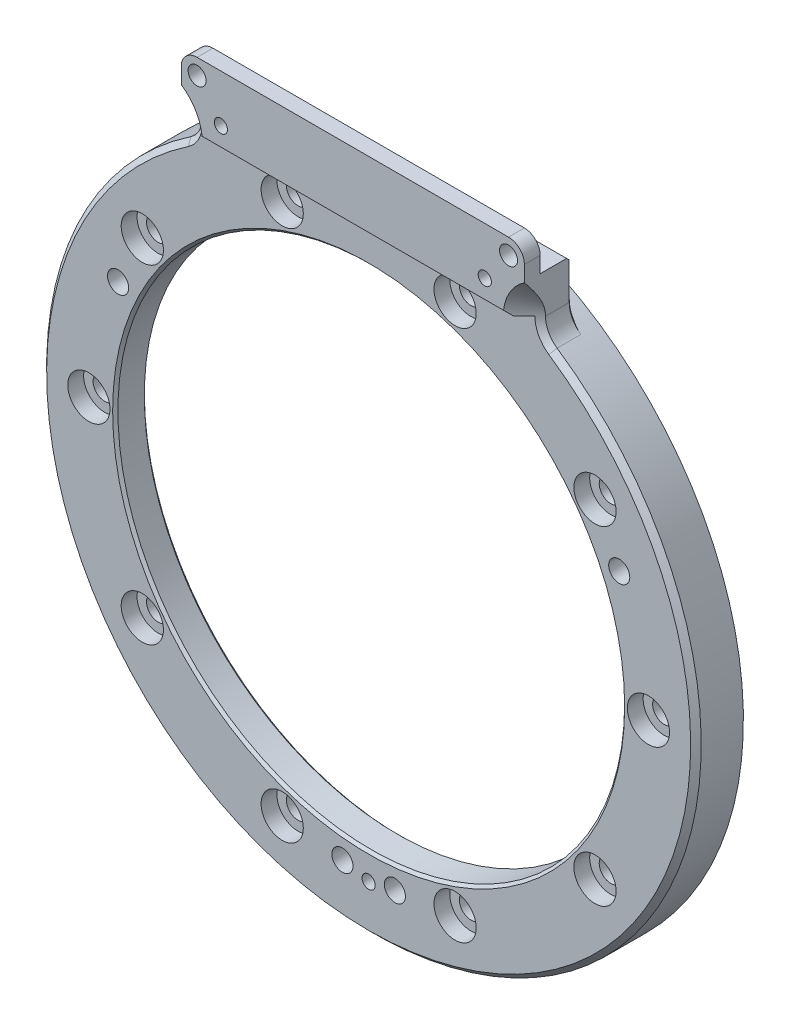
from build123d import *

# Parameters (mm, degrees)
SKETCH_1_R             = 62
SKETCH_1_R_2           = 60
EXTRUDE_1_DEPTH        = 3
EXTRUDE_START          = 6
SKETCH_2_R             = 48
EXTRUDE_2_DEPTH        = 6
FILLET_1_R             = 5
CHAMFER_1_SIZE         = 0.5
CHAMFER_2_SIZE         = 0.5
SKETCH_6_R             = 2.2
CUT_EXTRUDE_1_DEPTH    = 6
SKETCH_7_W             = 65
SKETCH_7_H             = 13.477482046
EXTRUDE_3_DEPTH        = 3
SKETCH_11_R            = 1.7
CUT_EXTRUDE_2_DEPTH    = 3
CHAMFER_3_SIZE         = 1
CHAMFER_4_SIZE         = 1
FILLET_2_R             = 3
CHAMFER_5_3_ANGLE      = 291.929687
SKETCH_12_R            = 4
CUT_EXTRUDE_3_DEPTH    = 3
CUT_EXTRUDE_4_DEPTH    = 2
CHAMFER_6_SIZE         = 1
HOLE_WIZARD_M3_1_D     = 2.5
HOLE_WIZARD_M3_1_DEPTH = 7.5
HOLE_WIZARD_M3_1_TIP   = 0.751075774
HOLE_WIZARD_M3_2_D     = 2.5
HOLE_WIZARD_M3_2_DEPTH = 7.5
HOLE_WIZARD_M3_2_TIP   = 0.751075774
SKETCH_21_R            = 2
CUT_EXTRUDE_5_DEPTH    = 13
SKETCH_22_R            = 2
CUT_EXTRUDE_6_DEPTH    = 13
SKETCH_25_R            = 2
CUT_EXTRUDE_8_DEPTH    = 10


with BuildPart() as part:
    # 草图1 → 凸台-拉伸1 (new body)
    with BuildSketch(Plane.XY):
        Circle(SKETCH_1_R)
        Circle(SKETCH_1_R_2, mode=Mode.SUBTRACT)
    extrude(amount=-EXTRUDE_1_DEPTH)

    # 草图2 → 凸台-拉伸2 (add)
    with BuildSketch(Plane.XY.offset(EXTRUDE_START)):
        with BuildLine():
            Line((-32.5, 63), (32.5, 63))
            Line((32.5, 63), (32.5, 52.79914772))
            ThreePointArc((32.5, 52.79914772), (0, -62), (-32.5, 52.79914772))
            Line((-32.5, 52.79914772), (-32.5, 63))
        make_face()
        Circle(SKETCH_2_R, mode=Mode.SUBTRACT)
    extrude(amount=-EXTRUDE_2_DEPTH)

    # 圆角1
    # the kernel refuses this fillet: 5 mm, written as the material it adds along each edge
    with BuildSketch(Plane(origin=(32.5, 52.79914772, 6), x_dir=(0.8403342947446245, -0.5420685132675156, 0), z_dir=(0, 0, -1))) as fillet_1_piece_1:
        with BuildLine():
            CenterArc((2.72541822, -4.998883971), FILLET_1_R, 91.210593649, 55.964843523)
            Line((-1.476253254, -2.288541405), (0, 0))
            ThreePointArc((0, 0), (1.309890927, -0.013838756), (2.619781855, 0))
        make_face()
    extrude(amount=6)
    with BuildSketch(Plane(origin=(-32.5, 52.79914772, 6), x_dir=(-0.840334294744627, -0.5420685132675117, 0), z_dir=(0, 0, -1))) as fillet_1_piece_2:
        with BuildLine():
            CenterArc((2.72541822, 4.998883971), FILLET_1_R, 212.824562828, 55.964843523)
            Line((-1.476253254, 2.288541405), (0, 0))
            ThreePointArc((0, 0), (1.309890927, 0.013838756), (2.619781855, 0))
        make_face()
    extrude(amount=6)

    # 倒角1
    chamfer_1_edges = [part.edges().sort_by_distance(p)[0] for p in [
        (-48, 0, 0),
        (-48, 0, 6),
        (-60, 0, -3),
    ]]
    chamfer(chamfer_1_edges, length=CHAMFER_1_SIZE)

    # 倒角2
    # the kernel refuses this chamfer: 0.5 mm, written as the material it takes off along each edge
    with BuildSketch(Plane(origin=(-32.5, 55.522517954, 0), x_dir=(0, 0, 1), z_dir=(0, 1, 0)), Plane(origin=(32.5, 64.285841494, 0), x_dir=(0, 0, 1), z_dir=(0, -1, 0))) as chamfer_2_piece_1:
        Polygon((CHAMFER_2_SIZE, 0), (0, CHAMFER_2_SIZE), (0, 0), align=None)
    extrude(amount=8.76332354, mode=Mode.SUBTRACT)
    with BuildSketch(Plane(origin=(37.5, 55.522517954, 0), x_dir=(-0.15613015555825177, -0.9877364904291813, 0), z_dir=(0.9877364904291813, -0.15613015555825177, 0))) as chamfer_2_piece_2_section:
        Polygon((5, -CHAMFER_2_SIZE), (5 + CHAMFER_2_SIZE, 0), (5, 0), align=None)
    chamfer_2_piece_2 = revolve(axis=Axis((37.5, 55.522517954, 0), (0, 0, -1)), revolution_arc=81.017652556, mode=Mode.PRIVATE)
    chamfer_2_piece_2 = chamfer_2_piece_2 - Plane(origin=(0, 0, 0), x_dir=(1, 0, 0), z_dir=(0, 0, 1)) * Cylinder(62, 22, mode=Mode.PRIVATE)
    add(chamfer_2_piece_2, mode=Mode.SUBTRACT)
    with BuildSketch(Plane(origin=(-37.5, 55.522517954, 0), x_dir=(1, 0, 0), z_dir=(0, 1, 0))) as chamfer_2_piece_3_section:
        Polygon((5, -CHAMFER_2_SIZE), (5 + CHAMFER_2_SIZE, 0), (5, 0), align=None)
    chamfer_2_piece_3 = revolve(axis=Axis((-37.5, 55.522517954, 0), (0, 0, -1)), revolution_arc=81.017652556, mode=Mode.PRIVATE)
    chamfer_2_piece_3 = chamfer_2_piece_3 - Plane(origin=(0, 0, 0), x_dir=(1, 0, 0), z_dir=(0, 0, 1)) * Cylinder(62, 22, mode=Mode.PRIVATE)
    add(chamfer_2_piece_3, mode=Mode.SUBTRACT)

    # 草图6 → 切除-拉伸1 (cut)
    with BuildSketch(Plane(origin=(0, 0, 0), x_dir=(-1, 0, 0), z_dir=(0, 0, -1))):
        with Locations((-42.877900702, 31.152618372)):
            Circle(SKETCH_6_R)
        with Locations((-53, 0)):
            Circle(SKETCH_6_R)
        with Locations((-42.877900702, -31.152618371)):
            Circle(SKETCH_6_R)
        with Locations((-16.377900702, -50.405995364)):
            Circle(SKETCH_6_R)
        with Locations((16.377900702, -50.405995364)):
            Circle(SKETCH_6_R)
        with Locations((42.877900702, -31.152618371)):
            Circle(SKETCH_6_R)
        with Locations((53, 0)):
            Circle(SKETCH_6_R)
        with Locations((42.877900702, 31.152618372)):
            Circle(SKETCH_6_R)
        with Locations((16.377900702, 50.405995364)):
            Circle(SKETCH_6_R)
        with Locations((-16.377900702, 50.405995364)):
            Circle(SKETCH_6_R)
    extrude(amount=-CUT_EXTRUDE_1_DEPTH, mode=Mode.SUBTRACT)

    # 草图7 → 凸台-拉伸3 (add)
    with BuildSketch(Plane.XY.offset(6)):
        with Locations((0, 62.261258977)):
            Rectangle(SKETCH_7_W, SKETCH_7_H)
    extrude(amount=EXTRUDE_3_DEPTH)

    # 草图11 → 切除-拉伸2 (cut)
    with BuildSketch(Plane.XY.offset(9)):
        with Locations((-29.5, 66)):
            Circle(SKETCH_11_R)
        with Locations((29.5, 66)):
            Circle(SKETCH_11_R)
    extrude(amount=-CUT_EXTRUDE_2_DEPTH, mode=Mode.SUBTRACT)

    # 倒角3
    chamfer_3_edges = [part.edges().sort_by_distance(p)[0] for p in [
        (0, 63, 0),
    ]]
    chamfer(chamfer_3_edges, length=CHAMFER_3_SIZE - 0.0001)  # a hair under: the kernel refuses the full size

    # 倒角4
    chamfer_4_edges = [part.edges().sort_by_distance(p)[0] for p in [
        (0, 55.522517954, 9),
    ]]
    chamfer(chamfer_4_edges, length=CHAMFER_4_SIZE)

    # 圆角2
    fillet_2_edges = [part.edges().sort_by_distance(p)[0] for p in [
        (-32.5, 69, 7.5),
        (32.5, 69, 7.5),
    ]]
    fillet(fillet_2_edges, radius=FILLET_2_R)

    # 倒角5: read off the stored shape, not the designer's step
    # 倒角5 outline → 倒角5 (revolve, cut)
    with BuildSketch(Plane(origin=(37.5, 55.522517954, 0), x_dir=(1, 0, 0), z_dir=(0, -1, 0))):
        Polygon((4.999998721, 9), (4.999998721, 4.999998721), (9, 9), align=None)
    revolve(axis=Axis((37.5, 55.522517954, 0), (0, 0, 1)), mode=Mode.SUBTRACT)

    # Chamfer 5 2 outline → Chamfer 5 2 (revolve, cut)
    with BuildSketch(Plane(origin=(-37.5, 55.522517954, 0), x_dir=(1, 0, 0), z_dir=(0, -1, 0))):
        Polygon((4.99999762, 9), (4.99999762, 4.99999762), (9, 9), align=None)
    revolve(axis=Axis((-37.5, 55.522517954, 0), (0, 0, 1)), mode=Mode.SUBTRACT)

    # Chamfer 5 3 outline → Chamfer 5 3 (revolve, cut)
    with BuildSketch(Plane(origin=(0, 0, 0), x_dir=(-0.5597014925373135, 0.8286942978273132, 0), z_dir=(0.8286942978273132, 0.5597014925373135, 0))):
        Polygon((62, 6), (61, 6), (62, 5), align=None)
    revolve(axis=Axis((0, 0, 0), (0, 0, 1)), revolution_arc=CHAMFER_5_3_ANGLE, mode=Mode.SUBTRACT)

    # 草图12 → 切除-拉伸3 (cut)
    with BuildSketch(Plane.XY.offset(6)):
        with Locations((-16.377900702, 50.405995364)):
            Circle(SKETCH_12_R)
        with Locations((16.377900702, 50.405995364)):
            Circle(SKETCH_12_R)
        with Locations((42.877900702, 31.152618372)):
            Circle(SKETCH_12_R)
        with Locations((53, 0)):
            Circle(SKETCH_12_R)
        with Locations((42.877900702, -31.152618371)):
            Circle(SKETCH_12_R)
        with Locations((16.377900702, -50.405995364)):
            Circle(SKETCH_12_R)
        with Locations((-16.377900702, -50.405995364)):
            Circle(SKETCH_12_R)
        with Locations((-42.877900702, -31.152618371)):
            Circle(SKETCH_12_R)
        with Locations((-53, 0)):
            Circle(SKETCH_12_R)
        with Locations((-42.877900702, 31.152618372)):
            Circle(SKETCH_12_R)
    extrude(amount=-CUT_EXTRUDE_3_DEPTH, mode=Mode.SUBTRACT)

    # 草图14 → 切除-拉伸4 (cut)
    with BuildSketch(Plane(origin=(0, 63, 0), x_dir=(1, 0, 0), z_dir=(0, 1, 0))):
        with BuildLine():
            ThreePointArc((-4.030108666, 3.809429698), (-11.733833556, 7.447967709), (-11.5, -1.068584287))
            ThreePointArc((-11.5, -1.068584287), (0, -4.15), (11.5, -1.068584287))
            ThreePointArc((11.5, -1.068584287), (11.733833556, 7.447967709), (4.030108666, 3.809429698))
            ThreePointArc((4.030108666, 3.809429698), (0, 5.85), (-4.030108666, 3.809429698))
        make_face()
    extrude(amount=-CUT_EXTRUDE_4_DEPTH, mode=Mode.SUBTRACT)

    # 倒角6
    # the kernel refuses this chamfer: 1 mm, written as the material it takes off along each edge
    with BuildSketch(Plane(origin=(18.80558547, 61, -3), x_dir=(0, -1, 0), z_dir=(-1, 0, 0))) as chamfer_6_piece_1:
        Polygon((CHAMFER_6_SIZE, 0), (0, CHAMFER_6_SIZE), (0, 0), align=None)
    extrude(amount=37.61117094, mode=Mode.SUBTRACT)
    with BuildSketch(Plane(origin=(-9, 63, -3.261542732), x_dir=(-0.874686173337968, 0, 0.48468969266055384), z_dir=(-0.48468969266055384, 0, -0.874686173337968))) as chamfer_6_piece_2:
        Polygon((5, -CHAMFER_6_SIZE), (5 + CHAMFER_6_SIZE, 0), (5, 0), align=None)
    revolve(axis=Axis((-9, 63, -3.261542732), (0, 1, 0)), revolution_arc=31.007856081, mode=Mode.SUBTRACT)
    with BuildSketch(Plane(origin=(9, 63, -3.261542732), x_dir=(0.49999999999998873, 0, 0.8660254037844451), z_dir=(-0.8660254037844451, 0, 0.49999999999998873))) as chamfer_6_piece_3:
        Polygon((5, -CHAMFER_6_SIZE), (5 + CHAMFER_6_SIZE, 0), (5, 0), align=None)
    revolve(axis=Axis((9, 63, -3.261542732), (0, 1, 0)), revolution_arc=31.007856081, mode=Mode.SUBTRACT)
    with BuildSketch(Plane(origin=(0, 63, -18.85), x_dir=(-0.500000000000001, 0, 0.8660254037844382), z_dir=(-0.8660254037844382, 0, -0.500000000000001))) as chamfer_6_piece_4:
        Polygon((23, -CHAMFER_6_SIZE), (23 + CHAMFER_6_SIZE, 0), (23, 0), align=None)
    revolve(axis=Axis((0, 63, -18.85), (0, 1, 0)), revolution_arc=60, mode=Mode.SUBTRACT)

    # M3 螺纹孔1
    with Locations(Plane.XY.offset(9)):
        with Locations((-25, 60), (25, 60)):
            Hole(HOLE_WIZARD_M3_1_D / 2, depth=HOLE_WIZARD_M3_1_DEPTH)
            with Locations((0, 0, -(HOLE_WIZARD_M3_1_DEPTH + HOLE_WIZARD_M3_1_TIP / 2))):  # 118° drill point
                Cone(0, HOLE_WIZARD_M3_1_D / 2, HOLE_WIZARD_M3_1_TIP, mode=Mode.SUBTRACT)

    # M3 螺纹孔2
    with Locations(Plane.XY.offset(6)):
        with Locations((0, -53)):
            Hole(HOLE_WIZARD_M3_2_D / 2, depth=HOLE_WIZARD_M3_2_DEPTH)
            with Locations((0, 0, -(HOLE_WIZARD_M3_2_DEPTH + HOLE_WIZARD_M3_2_TIP / 2))):  # 118° drill point
                Cone(0, HOLE_WIZARD_M3_2_D / 2, HOLE_WIZARD_M3_2_TIP, mode=Mode.SUBTRACT)

    # 草图21 → 切除-拉伸5 (cut)
    with BuildSketch(Plane.XY.offset(6)):
        with Locations((-4.968742047, -51.94347744)):
            Circle(SKETCH_21_R)
    extrude(amount=-CUT_EXTRUDE_5_DEPTH, mode=Mode.SUBTRACT)

    # 草图22 → 切除-拉伸6 (cut)
    with BuildSketch(Plane.XY.offset(6)):
        with Locations((-47.468742054, 21.668681868)):
            Circle(SKETCH_22_R)
    extrude(amount=-CUT_EXTRUDE_6_DEPTH, mode=Mode.SUBTRACT)

    # 草图25 → 切除-拉伸8 (cut)
    with BuildSketch(Plane.XY.offset(6)):
        with Locations((47.468742054, 21.668681868)):
            Circle(SKETCH_25_R)
        with Locations((4.968742047, -51.94347744)):
            Circle(SKETCH_25_R)
    extrude(amount=-CUT_EXTRUDE_8_DEPTH, mode=Mode.SUBTRACT)


solid = part.part
